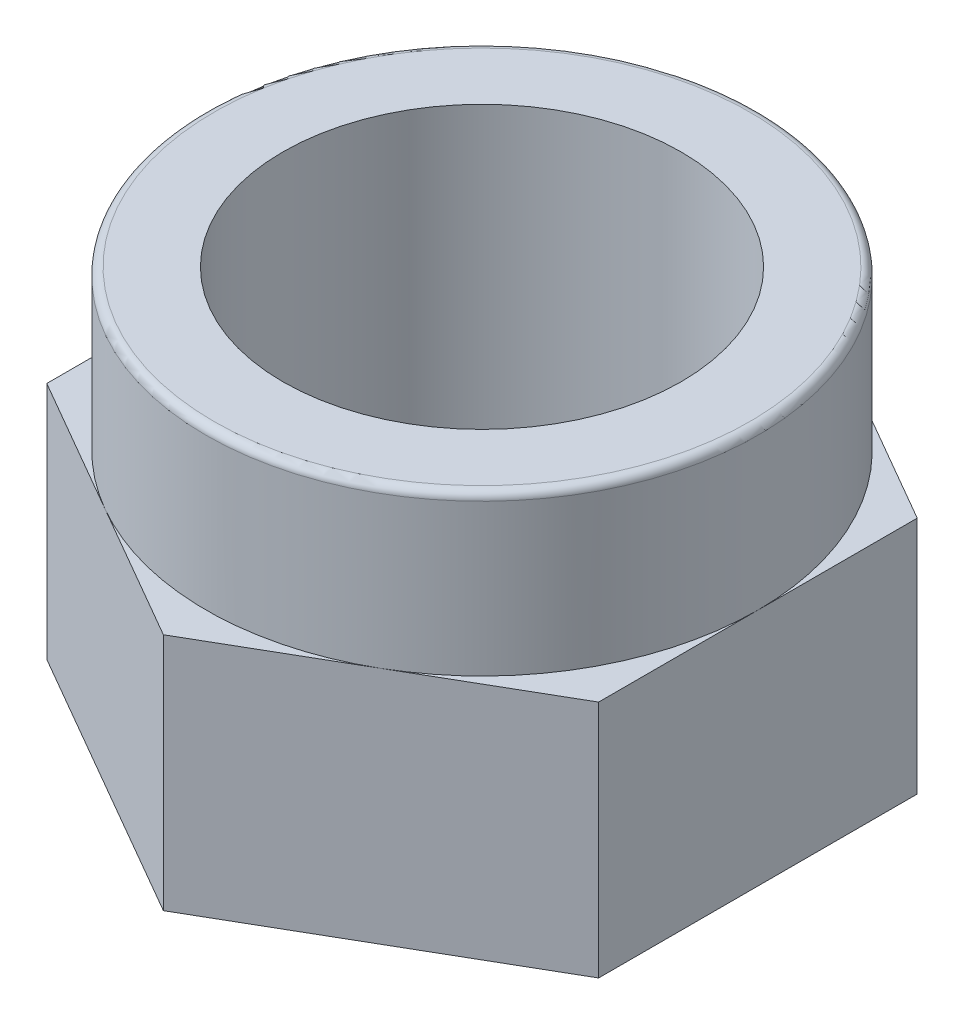
from build123d import *

# Parameters (mm, degrees)
SKETCH1_R           = 2.5
BOSS_EXTRUDE1_DEPTH = 3
SKETCH2_R           = 3.464101615
SKETCH2_R_2         = 2.5
BOSS_EXTRUDE2_DEPTH = 2
FILLET1_R           = 0.1


with BuildPart() as part:
    # Sketch1 → Boss-Extrude1 (new body)
    with BuildSketch(Plane(origin=(0, 0, 0), x_dir=(1, 0, 0), z_dir=(0, 1, 0))):
        Polygon((0, 4), (-3.464101615, 2), (-3.464101615, -2), (0, -4), (3.464101615, -2), (3.464101615, 2), align=None)
        Circle(SKETCH1_R, mode=Mode.SUBTRACT)
    extrude(amount=BOSS_EXTRUDE1_DEPTH)

    # Sketch2 → Boss-Extrude2 (add)
    with BuildSketch(Plane(origin=(0, 3, 0), x_dir=(1, 0, 0), z_dir=(0, 1, 0))):
        Circle(SKETCH2_R)
        Circle(SKETCH2_R_2, mode=Mode.SUBTRACT)
    extrude(amount=BOSS_EXTRUDE2_DEPTH)

    # Fillet1
    fillet1_edges = [part.edges().sort_by_distance(p)[0] for p in [
        (-3.464101615, 5, 0),
    ]]
    fillet(fillet1_edges, radius=FILLET1_R)


solid = part.part
